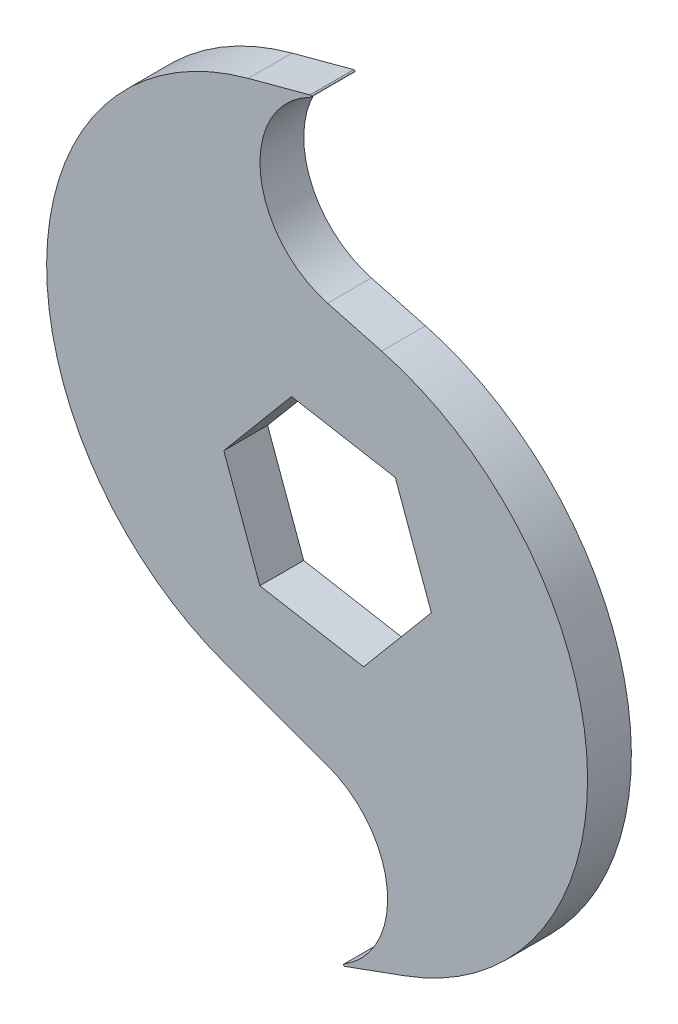
from build123d import *

# Parameters (mm, degrees)
BOSS_EXTRUDE1_DEPTH = 3.048
FILLET1_R           = 0.127


with BuildPart() as part:
    # Sketch1 → Boss-Extrude1 (new, symmetric)
    with BuildSketch(Plane.XY):
        with BuildLine():
            Line((0, 52.07), (-11.040532194, 49.111698314))
            ThreePointArc((-11.040532194, 49.111698314), (-39.066320922, 14.192289272), (-14.190605813, -23.03684931))
            Line((-14.190605813, -23.03684931), (0, -28.201807432))
            ThreePointArc((0, -28.201807432), (8.35634418, -40.135903716), (0, -52.07))
            Line((0, -52.07), (10.740686656, -48.160709762))
            ThreePointArc((10.740686656, -48.160709762), (36.144496882, -10.141220984), (7.52373904, 25.519504212))
            Line((7.52373904, 25.519504212), (0, 27.535484012))
            ThreePointArc((0, 27.535484012), (-9.412998127, 39.802742006), (0, 52.07))
        make_face()
        Polygon((-5.015621714, 13.780307404), (-14.441907141, 2.546497882), (-9.426285427, -11.233809522), (5.015621714, -13.780307404), (14.441907141, -2.546497882), (9.426285427, 11.233809522), align=None, mode=Mode.SUBTRACT)
    extrude(amount=BOSS_EXTRUDE1_DEPTH, both=True)

    # Fillet1
    fillet1_edges = [part.edges().sort_by_distance(p)[0] for p in [
        (0, 52.07, 0),
        (0, -52.07, 0),
    ]]
    fillet(fillet1_edges, radius=FILLET1_R)


solid = part.part
